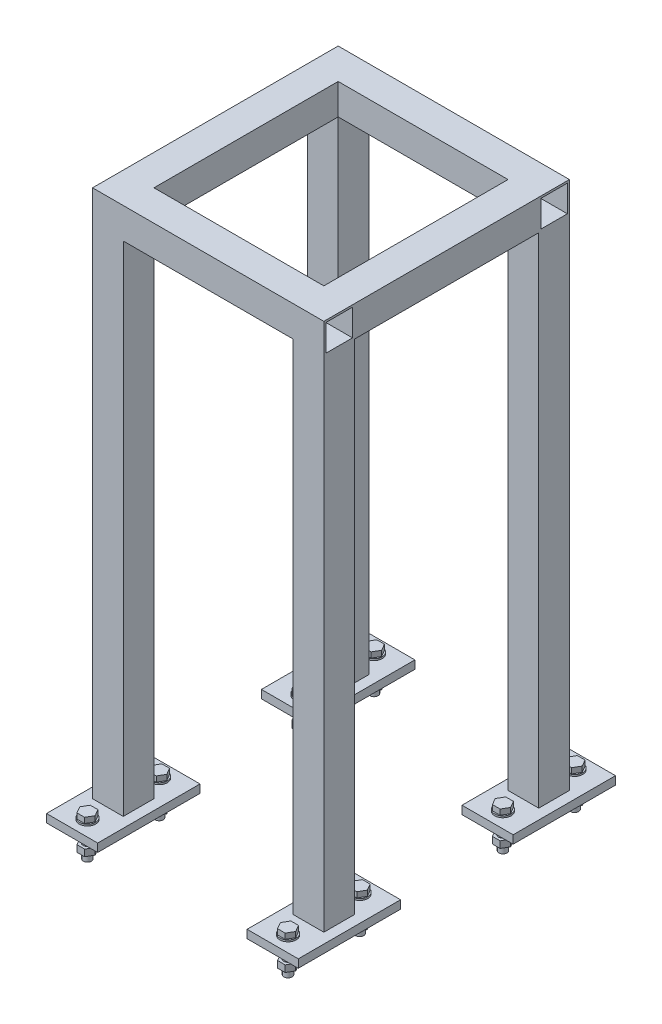
from build123d import *

# Parameters (mm, degrees)
FEET_START             = -329
SKETCH_1_W             = 50
SKETCH_1_H             = 100
FEET_DEPTH             = 8
FEET_2_DEPTH           = 8
FEET_3_DEPTH           = 8
FEET_4_DEPTH           = 8
POSTS_START            = -321
POSTS_OUTLINE_W        = 30
POSTS_OUTLINE_H        = 30
POSTS_OUTLINE_W_2      = 26
POSTS_OUTLINE_H_2      = 26
POSTS_DEPTH            = 487
SKETCH_3_W             = 30
SKETCH_3_H             = 30
SKETCH_3_W_2           = 26
SKETCH_3_H_2           = 26
LONG_RAILS_DEPTH       = 113
SKETCH_4_W             = 30
SKETCH_4_H             = 30
SKETCH_4_W_2           = 26
SKETCH_4_H_2           = 26
CROSS_RAILS_DEPTH      = 90
FOOT_START             = -325
SKETCH_5_R             = 4.5
FOOT_HOLES_DEPTH       = 4
MOUNTING_START         = -354.4
SKETCH_6_R             = 4
MOUNTING_BOLTS_DEPTH   = 35
MOUNTING_BOLTS_2_DEPTH = 35
MOUNTING_BOLTS_3_DEPTH = 35
MOUNTING_BOLTS_4_DEPTH = 35
MOUNTING_BOLTS_5_DEPTH = 35
MOUNTING_BOLTS_6_DEPTH = 35
MOUNTING_BOLTS_7_DEPTH = 35
MOUNTING_BOLTS_8_DEPTH = 35
WASHERS_START          = -321
SKETCH_7_R             = 8
SKETCH_7_R_2           = 4.2
WASHERS_DEPTH          = 1.6
WASHERS_2_DEPTH        = 1.6
WASHERS_3_DEPTH        = 1.6
WASHERS_4_DEPTH        = 1.6
WASHERS_5_DEPTH        = 1.6
WASHERS_6_DEPTH        = 1.6
WASHERS_7_DEPTH        = 1.6
WASHERS_8_DEPTH        = 1.6
BOLT_START             = -319.4
BOLT_HEADS_DEPTH       = 5.3
NUTS_START             = -347.5
SKETCH_9_R             = 4.2
NUTS_DEPTH             = 6.5
NUTS_2_DEPTH           = 6.5
NUTS_3_DEPTH           = 6.5
NUTS_4_DEPTH           = 6.5
NUTS_5_DEPTH           = 6.5
NUTS_6_DEPTH           = 6.5
NUTS_7_DEPTH           = 6.5
NUTS_8_DEPTH           = 6.5


# Read off the part's stored shape, not the designer's step: Posts
with BuildPart() as part:
    # 草图1 → Feet (new body)
    with BuildSketch(Plane(origin=(0, 0, 0), x_dir=(1, 0, 0), z_dir=(0, 1, 0)).offset(FEET_START)):
        with Locations((-98, 105)):
            Rectangle(SKETCH_1_W, SKETCH_1_H)
    extrude(amount=FEET_DEPTH)



with BuildPart() as body_2:
    # 草图1 → Feet 2 (new body)
    with BuildSketch(Plane(origin=(0, 0, 0), x_dir=(1, 0, 0), z_dir=(0, 1, 0)).offset(FEET_START)):
        with Locations((-98, -105)):
            Rectangle(SKETCH_1_W, SKETCH_1_H)
    extrude(amount=FEET_2_DEPTH)


with BuildPart() as body_3:
    # 草图1 → Feet 3 (new body)
    with BuildSketch(Plane(origin=(0, 0, 0), x_dir=(1, 0, 0), z_dir=(0, 1, 0)).offset(FEET_START)):
        with Locations((98, 105)):
            Rectangle(SKETCH_1_W, SKETCH_1_H)
    extrude(amount=FEET_3_DEPTH)


with BuildPart() as body_4:
    # 草图1 → Feet 4 (new body)
    with BuildSketch(Plane(origin=(0, 0, 0), x_dir=(1, 0, 0), z_dir=(0, 1, 0)).offset(FEET_START)):
        with Locations((98, -105)):
            Rectangle(SKETCH_1_W, SKETCH_1_H)
    extrude(amount=FEET_4_DEPTH)


with BuildPart() as part_1:
    add(part.part)

    add(body_2.part)  # Posts merges body 2

    add(body_3.part)  # Posts merges body 3

    add(body_4.part)  # Posts merges body 4
    # Posts outline → Posts (add)
    # profile 1 of 4: a face of its own
    with BuildSketch(Plane(origin=(0, 0, 0), x_dir=(1, 0, 0), z_dir=(0, 1, 0)).offset(POSTS_START)):
        with Locations((-98, 105)):
            Rectangle(POSTS_OUTLINE_W, POSTS_OUTLINE_H)
        with Locations((-98, 105)):
            Rectangle(POSTS_OUTLINE_W_2, POSTS_OUTLINE_H_2, mode=Mode.SUBTRACT)
    # profile 2 of 4: a face of its own
    with BuildSketch(Plane(origin=(0, 0, 0), x_dir=(1, 0, 0), z_dir=(0, 1, 0)).offset(POSTS_START)):
        with Locations((-98, -105)):
            Rectangle(POSTS_OUTLINE_W, POSTS_OUTLINE_H)
        with Locations((-98, -105)):
            Rectangle(POSTS_OUTLINE_W_2, POSTS_OUTLINE_H_2, mode=Mode.SUBTRACT)
    # profile 3 of 4: a face of its own
    with BuildSketch(Plane(origin=(0, 0, 0), x_dir=(1, 0, 0), z_dir=(0, 1, 0)).offset(POSTS_START)):
        with Locations((98, 105)):
            Rectangle(POSTS_OUTLINE_W, POSTS_OUTLINE_H)
        with Locations((98, 105)):
            Rectangle(POSTS_OUTLINE_W_2, POSTS_OUTLINE_H_2, mode=Mode.SUBTRACT)
    # profile 4 of 4: a face of its own
    with BuildSketch(Plane(origin=(0, 0, 0), x_dir=(1, 0, 0), z_dir=(0, 1, 0)).offset(POSTS_START)):
        with Locations((98, -105)):
            Rectangle(POSTS_OUTLINE_W, POSTS_OUTLINE_H)
        with Locations((98, -105)):
            Rectangle(POSTS_OUTLINE_W_2, POSTS_OUTLINE_H_2, mode=Mode.SUBTRACT)
    extrude(amount=POSTS_DEPTH)

    # 草图3 → Long Rails (add, symmetric)
    # profile 1 of 2: a face of its own
    with BuildSketch(Plane(origin=(0, 0, 0), x_dir=(0, 0, -1), z_dir=(1, 0, 0))):
        with Locations((105, 181)):
            Rectangle(SKETCH_3_W, SKETCH_3_H)
        with Locations((105, 181)):
            Rectangle(SKETCH_3_W_2, SKETCH_3_H_2, mode=Mode.SUBTRACT)
    # profile 2 of 2: a face of its own
    with BuildSketch(Plane(origin=(0, 0, 0), x_dir=(0, 0, -1), z_dir=(1, 0, 0))):
        with Locations((-105, 181)):
            Rectangle(SKETCH_3_W, SKETCH_3_H)
        with Locations((-105, 181)):
            Rectangle(SKETCH_3_W_2, SKETCH_3_H_2, mode=Mode.SUBTRACT)
    extrude(amount=LONG_RAILS_DEPTH, both=True)

    # 草图4 → Cross Rails (add, symmetric)
    # profile 1 of 2: a face of its own
    with BuildSketch(Plane.XY):
        with Locations((-98, 181)):
            Rectangle(SKETCH_4_W, SKETCH_4_H)
        with Locations((-98, 181)):
            Rectangle(SKETCH_4_W_2, SKETCH_4_H_2, mode=Mode.SUBTRACT)
    # profile 2 of 2: a face of its own
    with BuildSketch(Plane.XY):
        with Locations((98, 181)):
            Rectangle(SKETCH_4_W, SKETCH_4_H)
        with Locations((98, 181)):
            Rectangle(SKETCH_4_W_2, SKETCH_4_H_2, mode=Mode.SUBTRACT)
    extrude(amount=CROSS_RAILS_DEPTH, both=True)

    # 草图5 → Foot Holes (cut, symmetric)
    with BuildSketch(Plane(origin=(0, 0, 0), x_dir=(1, 0, 0), z_dir=(0, 1, 0)).offset(FOOT_START)):
        with Locations(Location((-98, 140, 0), (0, 0, 270))):
            Circle(SKETCH_5_R)
        with Locations(Location((-98, 70, 0), (0, 0, 270))):
            Circle(SKETCH_5_R)
        with Locations(Location((-98, -70, 0), (0, 0, 270))):
            Circle(SKETCH_5_R)
        with Locations(Location((-98, -140, 0), (0, 0, 270))):
            Circle(SKETCH_5_R)
        with Locations(Location((98, 140, 0), (0, 0, 270))):
            Circle(SKETCH_5_R)
        with Locations(Location((98, 70, 0), (0, 0, 270))):
            Circle(SKETCH_5_R)
        with Locations(Location((98, -70, 0), (0, 0, 270))):
            Circle(SKETCH_5_R)
        with Locations(Location((98, -140, 0), (0, 0, 270))):
            Circle(SKETCH_5_R)
    extrude(amount=FOOT_HOLES_DEPTH, both=True, mode=Mode.SUBTRACT)



with BuildPart() as body_2_2:
    # 草图6 → Mounting Bolts (new body)
    with BuildSketch(Plane(origin=(0, 0, 0), x_dir=(1, 0, 0), z_dir=(0, 1, 0)).offset(MOUNTING_START)):
        with Locations(Location((-98, 140, 0), (0, 0, 270))):
            Circle(SKETCH_6_R)
    extrude(amount=MOUNTING_BOLTS_DEPTH)


with BuildPart() as body_3_2:
    # 草图6 → Mounting Bolts 2 (new body)
    with BuildSketch(Plane(origin=(0, 0, 0), x_dir=(1, 0, 0), z_dir=(0, 1, 0)).offset(MOUNTING_START)):
        with Locations(Location((-98, 70, 0), (0, 0, 270))):
            Circle(SKETCH_6_R)
    extrude(amount=MOUNTING_BOLTS_2_DEPTH)


with BuildPart() as body_4_2:
    # 草图6 → Mounting Bolts 3 (new body)
    with BuildSketch(Plane(origin=(0, 0, 0), x_dir=(1, 0, 0), z_dir=(0, 1, 0)).offset(MOUNTING_START)):
        with Locations(Location((-98, -70, 0), (0, 0, 270))):
            Circle(SKETCH_6_R)
    extrude(amount=MOUNTING_BOLTS_3_DEPTH)


with BuildPart() as body_5:
    # 草图6 → Mounting Bolts 4 (new body)
    with BuildSketch(Plane(origin=(0, 0, 0), x_dir=(1, 0, 0), z_dir=(0, 1, 0)).offset(MOUNTING_START)):
        with Locations(Location((-98, -140, 0), (0, 0, 270))):
            Circle(SKETCH_6_R)
    extrude(amount=MOUNTING_BOLTS_4_DEPTH)


with BuildPart() as body_6:
    # 草图6 → Mounting Bolts 5 (new body)
    with BuildSketch(Plane(origin=(0, 0, 0), x_dir=(1, 0, 0), z_dir=(0, 1, 0)).offset(MOUNTING_START)):
        with Locations(Location((98, 140, 0), (0, 0, 270))):
            Circle(SKETCH_6_R)
    extrude(amount=MOUNTING_BOLTS_5_DEPTH)


with BuildPart() as body_7:
    # 草图6 → Mounting Bolts 6 (new body)
    with BuildSketch(Plane(origin=(0, 0, 0), x_dir=(1, 0, 0), z_dir=(0, 1, 0)).offset(MOUNTING_START)):
        with Locations(Location((98, 70, 0), (0, 0, 270))):
            Circle(SKETCH_6_R)
    extrude(amount=MOUNTING_BOLTS_6_DEPTH)


with BuildPart() as body_8:
    # 草图6 → Mounting Bolts 7 (new body)
    with BuildSketch(Plane(origin=(0, 0, 0), x_dir=(1, 0, 0), z_dir=(0, 1, 0)).offset(MOUNTING_START)):
        with Locations(Location((98, -70, 0), (0, 0, 270))):
            Circle(SKETCH_6_R)
    extrude(amount=MOUNTING_BOLTS_7_DEPTH)


with BuildPart() as body_9:
    # 草图6 → Mounting Bolts 8 (new body)
    with BuildSketch(Plane(origin=(0, 0, 0), x_dir=(1, 0, 0), z_dir=(0, 1, 0)).offset(MOUNTING_START)):
        with Locations(Location((98, -140, 0), (0, 0, 270))):
            Circle(SKETCH_6_R)
    extrude(amount=MOUNTING_BOLTS_8_DEPTH)


with BuildPart() as body_10:
    # 草图7 → Washers (new body)
    with BuildSketch(Plane(origin=(0, 0, 0), x_dir=(1, 0, 0), z_dir=(0, 1, 0)).offset(WASHERS_START)):
        with Locations(Location((-98, 140, 0), (0, 0, 270))):
            Circle(SKETCH_7_R)
        with Locations(Location((-98, 140, 0), (0, 0, 270))):
            Circle(SKETCH_7_R_2, mode=Mode.SUBTRACT)
    extrude(amount=WASHERS_DEPTH)


with BuildPart() as body_11:
    # 草图7 → Washers 2 (new body)
    with BuildSketch(Plane(origin=(0, 0, 0), x_dir=(1, 0, 0), z_dir=(0, 1, 0)).offset(WASHERS_START)):
        with Locations(Location((-98, 70, 0), (0, 0, 270))):
            Circle(SKETCH_7_R)
        with Locations(Location((-98, 70, 0), (0, 0, 270))):
            Circle(SKETCH_7_R_2, mode=Mode.SUBTRACT)
    extrude(amount=WASHERS_2_DEPTH)


with BuildPart() as body_12:
    # 草图7 → Washers 3 (new body)
    with BuildSketch(Plane(origin=(0, 0, 0), x_dir=(1, 0, 0), z_dir=(0, 1, 0)).offset(WASHERS_START)):
        with Locations(Location((-98, -70, 0), (0, 0, 270))):
            Circle(SKETCH_7_R)
        with Locations(Location((-98, -70, 0), (0, 0, 270))):
            Circle(SKETCH_7_R_2, mode=Mode.SUBTRACT)
    extrude(amount=WASHERS_3_DEPTH)


with BuildPart() as body_13:
    # 草图7 → Washers 4 (new body)
    with BuildSketch(Plane(origin=(0, 0, 0), x_dir=(1, 0, 0), z_dir=(0, 1, 0)).offset(WASHERS_START)):
        with Locations(Location((-98, -140, 0), (0, 0, 270))):
            Circle(SKETCH_7_R)
        with Locations(Location((-98, -140, 0), (0, 0, 270))):
            Circle(SKETCH_7_R_2, mode=Mode.SUBTRACT)
    extrude(amount=WASHERS_4_DEPTH)


with BuildPart() as body_14:
    # 草图7 → Washers 5 (new body)
    with BuildSketch(Plane(origin=(0, 0, 0), x_dir=(1, 0, 0), z_dir=(0, 1, 0)).offset(WASHERS_START)):
        with Locations(Location((98, 140, 0), (0, 0, 270))):
            Circle(SKETCH_7_R)
        with Locations(Location((98, 140, 0), (0, 0, 270))):
            Circle(SKETCH_7_R_2, mode=Mode.SUBTRACT)
    extrude(amount=WASHERS_5_DEPTH)


with BuildPart() as body_15:
    # 草图7 → Washers 6 (new body)
    with BuildSketch(Plane(origin=(0, 0, 0), x_dir=(1, 0, 0), z_dir=(0, 1, 0)).offset(WASHERS_START)):
        with Locations(Location((98, 70, 0), (0, 0, 270))):
            Circle(SKETCH_7_R)
        with Locations(Location((98, 70, 0), (0, 0, 270))):
            Circle(SKETCH_7_R_2, mode=Mode.SUBTRACT)
    extrude(amount=WASHERS_6_DEPTH)


with BuildPart() as body_16:
    # 草图7 → Washers 7 (new body)
    with BuildSketch(Plane(origin=(0, 0, 0), x_dir=(1, 0, 0), z_dir=(0, 1, 0)).offset(WASHERS_START)):
        with Locations(Location((98, -70, 0), (0, 0, 270))):
            Circle(SKETCH_7_R)
        with Locations(Location((98, -70, 0), (0, 0, 270))):
            Circle(SKETCH_7_R_2, mode=Mode.SUBTRACT)
    extrude(amount=WASHERS_7_DEPTH)


with BuildPart() as body_17:
    # 草图7 → Washers 8 (new body)
    with BuildSketch(Plane(origin=(0, 0, 0), x_dir=(1, 0, 0), z_dir=(0, 1, 0)).offset(WASHERS_START)):
        with Locations(Location((98, -140, 0), (0, 0, 270))):
            Circle(SKETCH_7_R)
        with Locations(Location((98, -140, 0), (0, 0, 270))):
            Circle(SKETCH_7_R_2, mode=Mode.SUBTRACT)
    extrude(amount=WASHERS_8_DEPTH)


with BuildPart() as part_2:
    add(part_1.part)

    add(body_10.part)  # Bolt Heads merges body 10

    add(body_11.part)  # Bolt Heads merges body 11

    add(body_12.part)  # Bolt Heads merges body 12

    add(body_13.part)  # Bolt Heads merges body 13

    add(body_14.part)  # Bolt Heads merges body 14

    add(body_15.part)  # Bolt Heads merges body 15

    add(body_16.part)  # Bolt Heads merges body 16

    add(body_17.part)  # Bolt Heads merges body 17

    add(body_2_2.part)  # Bolt Heads merges body 2 2

    add(body_3_2.part)  # Bolt Heads merges body 3 2

    add(body_4_2.part)  # Bolt Heads merges body 4 2

    add(body_5.part)  # Bolt Heads merges body 5

    add(body_6.part)  # Bolt Heads merges body 6

    add(body_7.part)  # Bolt Heads merges body 7

    add(body_8.part)  # Bolt Heads merges body 8

    add(body_9.part)  # Bolt Heads merges body 9
    # 草图8 → Bolt Heads (add)
    with BuildSketch(Plane(origin=(0, 0, 0), x_dir=(1, 0, 0), z_dir=(0, 1, 0)).offset(BOLT_START)):
        Polygon((-90.494446501, 140), (-94.24722325, 133.5), (-101.75277675, 133.5), (-105.505553499, 140), (-101.75277675, 146.5), (-94.24722325, 146.5), align=None)
        Polygon((-90.494446501, 70), (-94.24722325, 63.5), (-101.75277675, 63.5), (-105.505553499, 70), (-101.75277675, 76.5), (-94.24722325, 76.5), align=None)
        Polygon((-90.494446501, -70), (-94.24722325, -76.5), (-101.75277675, -76.5), (-105.505553499, -70), (-101.75277675, -63.5), (-94.24722325, -63.5), align=None)
        Polygon((-90.494446501, -140), (-94.24722325, -146.5), (-101.75277675, -146.5), (-105.505553499, -140), (-101.75277675, -133.5), (-94.24722325, -133.5), align=None)
        Polygon((105.505553499, 140), (101.75277675, 133.5), (94.24722325, 133.5), (90.494446501, 140), (94.24722325, 146.5), (101.75277675, 146.5), align=None)
        Polygon((105.505553499, 70), (101.75277675, 63.5), (94.24722325, 63.5), (90.494446501, 70), (94.24722325, 76.5), (101.75277675, 76.5), align=None)
        Polygon((105.505553499, -70), (101.75277675, -76.5), (94.24722325, -76.5), (90.494446501, -70), (94.24722325, -63.5), (101.75277675, -63.5), align=None)
        Polygon((105.505553499, -140), (101.75277675, -146.5), (94.24722325, -146.5), (90.494446501, -140), (94.24722325, -133.5), (101.75277675, -133.5), align=None)
    extrude(amount=BOLT_HEADS_DEPTH)


with BuildPart() as body_2_3:
    # 草图9 → Nuts (new body)
    with BuildSketch(Plane(origin=(0, 0, 0), x_dir=(1, 0, 0), z_dir=(0, 1, 0)).offset(NUTS_START)):
        Polygon((-90.494446501, 140), (-94.24722325, 133.5), (-101.75277675, 133.5), (-105.505553499, 140), (-101.75277675, 146.5), (-94.24722325, 146.5), align=None)
        with Locations(Location((-98, 140, 0), (0, 0, 90))):
            Circle(SKETCH_9_R, mode=Mode.SUBTRACT)
    extrude(amount=NUTS_DEPTH)


with BuildPart() as body_3_3:
    # 草图9 → Nuts 2 (new body)
    with BuildSketch(Plane(origin=(0, 0, 0), x_dir=(1, 0, 0), z_dir=(0, 1, 0)).offset(NUTS_START)):
        Polygon((-90.494446501, 70), (-94.24722325, 63.5), (-101.75277675, 63.5), (-105.505553499, 70), (-101.75277675, 76.5), (-94.24722325, 76.5), align=None)
        with Locations(Location((-98, 70, 0), (0, 0, 90))):
            Circle(SKETCH_9_R, mode=Mode.SUBTRACT)
    extrude(amount=NUTS_2_DEPTH)


with BuildPart() as body_4_3:
    # 草图9 → Nuts 3 (new body)
    with BuildSketch(Plane(origin=(0, 0, 0), x_dir=(1, 0, 0), z_dir=(0, 1, 0)).offset(NUTS_START)):
        Polygon((-90.494446501, -70), (-94.24722325, -76.5), (-101.75277675, -76.5), (-105.505553499, -70), (-101.75277675, -63.5), (-94.24722325, -63.5), align=None)
        with Locations(Location((-98, -70, 0), (0, 0, 90))):
            Circle(SKETCH_9_R, mode=Mode.SUBTRACT)
    extrude(amount=NUTS_3_DEPTH)


with BuildPart() as body_5_2:
    # 草图9 → Nuts 4 (new body)
    with BuildSketch(Plane(origin=(0, 0, 0), x_dir=(1, 0, 0), z_dir=(0, 1, 0)).offset(NUTS_START)):
        Polygon((-90.494446501, -140), (-94.24722325, -146.5), (-101.75277675, -146.5), (-105.505553499, -140), (-101.75277675, -133.5), (-94.24722325, -133.5), align=None)
        with Locations(Location((-98, -140, 0), (0, 0, 90))):
            Circle(SKETCH_9_R, mode=Mode.SUBTRACT)
    extrude(amount=NUTS_4_DEPTH)


with BuildPart() as body_6_2:
    # 草图9 → Nuts 5 (new body)
    with BuildSketch(Plane(origin=(0, 0, 0), x_dir=(1, 0, 0), z_dir=(0, 1, 0)).offset(NUTS_START)):
        Polygon((105.505553499, 140), (101.75277675, 133.5), (94.24722325, 133.5), (90.494446501, 140), (94.24722325, 146.5), (101.75277675, 146.5), align=None)
        with Locations(Location((98, 140, 0), (0, 0, 90))):
            Circle(SKETCH_9_R, mode=Mode.SUBTRACT)
    extrude(amount=NUTS_5_DEPTH)


with BuildPart() as body_7_2:
    # 草图9 → Nuts 6 (new body)
    with BuildSketch(Plane(origin=(0, 0, 0), x_dir=(1, 0, 0), z_dir=(0, 1, 0)).offset(NUTS_START)):
        Polygon((105.505553499, 70), (101.75277675, 63.5), (94.24722325, 63.5), (90.494446501, 70), (94.24722325, 76.5), (101.75277675, 76.5), align=None)
        with Locations(Location((98, 70, 0), (0, 0, 90))):
            Circle(SKETCH_9_R, mode=Mode.SUBTRACT)
    extrude(amount=NUTS_6_DEPTH)


with BuildPart() as body_8_2:
    # 草图9 → Nuts 7 (new body)
    with BuildSketch(Plane(origin=(0, 0, 0), x_dir=(1, 0, 0), z_dir=(0, 1, 0)).offset(NUTS_START)):
        Polygon((105.505553499, -70), (101.75277675, -76.5), (94.24722325, -76.5), (90.494446501, -70), (94.24722325, -63.5), (101.75277675, -63.5), align=None)
        with Locations(Location((98, -70, 0), (0, 0, 90))):
            Circle(SKETCH_9_R, mode=Mode.SUBTRACT)
    extrude(amount=NUTS_7_DEPTH)


with BuildPart() as body_9_2:
    # 草图9 → Nuts 8 (new body)
    with BuildSketch(Plane(origin=(0, 0, 0), x_dir=(1, 0, 0), z_dir=(0, 1, 0)).offset(NUTS_START)):
        Polygon((105.505553499, -140), (101.75277675, -146.5), (94.24722325, -146.5), (90.494446501, -140), (94.24722325, -133.5), (101.75277675, -133.5), align=None)
        with Locations(Location((98, -140, 0), (0, 0, 90))):
            Circle(SKETCH_9_R, mode=Mode.SUBTRACT)
    extrude(amount=NUTS_8_DEPTH)


solid = Compound([part_2.part, body_2_3.part, body_3_3.part, body_4_3.part, body_5_2.part, body_6_2.part, body_7_2.part, body_8_2.part, body_9_2.part])
